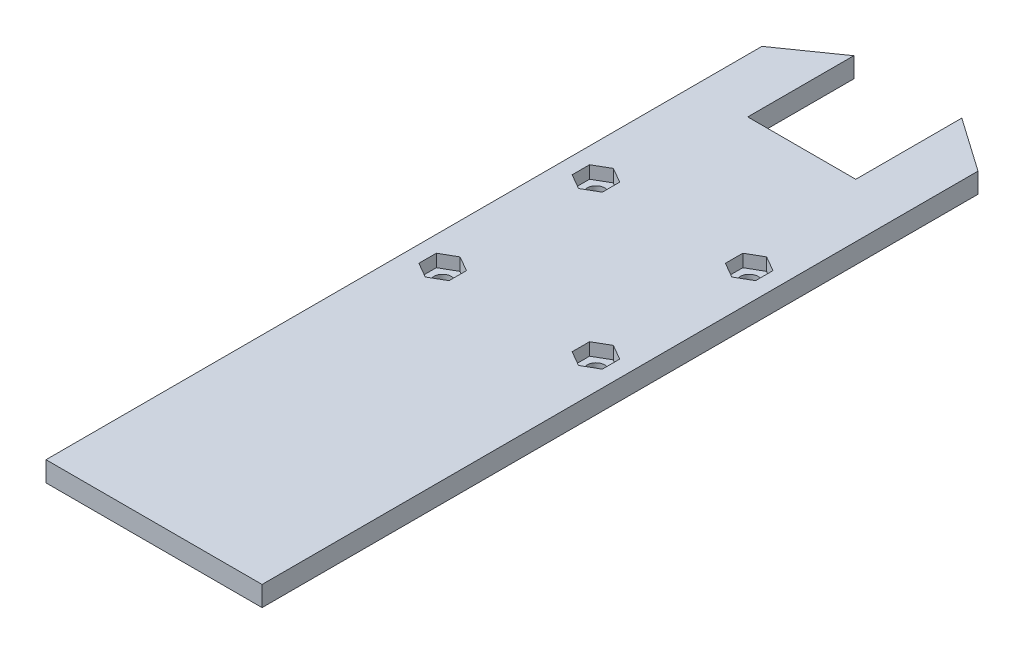
from build123d import *

# Parameters (mm, degrees)
SKETCH1_W           = 43
SKETCH1_H           = 150
BOSS_EXTRUDE1_DEPTH = 4
SKETCH2_W           = 10.57
SKETCH2_H           = 21.1
SKETCH2_W_2         = 10.75
CUT_EXTRUDE1_DEPTH  = 79.123299982
CUT_EXTRUDE2_DEPTH  = 2.5
SKETCH4_R           = 1.75
CUT_EXTRUDE3_DEPTH  = 79.123299982
SKETCH6_W           = 0.18
SKETCH6_H           = 21.1
CUT_EXTRUDE5_DEPTH  = 79.123299982
CUT_EXTRUDE6_DEPTH  = 79.123299982


with BuildPart() as part:
    # Sketch1 → Boss-Extrude1 (new body)
    with BuildSketch(Plane(origin=(0, 0, 0), x_dir=(1, 0, 0), z_dir=(0, 1, 0))):
        Rectangle(SKETCH1_W, SKETCH1_H)
    extrude(amount=BOSS_EXTRUDE1_DEPTH)

    # Sketch2 → Cut-Extrude1 (cut, through all)
    with BuildSketch(Plane(origin=(0, 4, 0), x_dir=(1, 0, 0), z_dir=(0, 1, 0))):
        with Locations((5.285, 64.45)):
            Rectangle(SKETCH2_W, SKETCH2_H)
        with Locations((-5.375, 64.45)):
            Rectangle(SKETCH2_W_2, SKETCH2_H)
    extrude(amount=-CUT_EXTRUDE1_DEPTH, mode=Mode.SUBTRACT)

    # Sketch3 → Cut-Extrude2 (cut)
    with BuildSketch(Plane(origin=(0, 4, 0), x_dir=(1, 0, 0), z_dir=(0, 1, 0))):
        Polygon((-15.25, 31.654101615), (-18.25, 29.922050808), (-18.25, 26.457949192), (-15.25, 24.725898385), (-12.25, 26.457949192), (-12.25, 29.922050808), align=None)
        Polygon((12.25, 29.922050808), (15.25, 31.654101615), (18.25, 29.922050808), (18.25, 26.457949192), (15.25, 24.725898385), (12.25, 26.457949192), align=None)
        Polygon((12.25, -0.577949192), (12.25, -4.042050808), (15.25, -5.774101615), (18.25, -4.042050808), (18.25, -0.577949192), (15.25, 1.154101615), align=None)
        Polygon((-12.25, -4.042050808), (-15.25, -5.774101615), (-18.25, -4.042050808), (-18.25, -0.577949192), (-15.25, 1.154101615), (-12.25, -0.577949192), align=None)
    extrude(amount=-CUT_EXTRUDE2_DEPTH, mode=Mode.SUBTRACT)

    # Sketch4 → Cut-Extrude3 (cut, through all)
    with BuildSketch(Plane(origin=(0, 4, 0), x_dir=(1, 0, 0), z_dir=(0, 1, 0))):
        with Locations((-15.25, 28.19)):
            Circle(SKETCH4_R)
        with Locations((15.25, 28.19)):
            Circle(SKETCH4_R)
        with Locations((15.25, -2.31)):
            Circle(SKETCH4_R)
        with Locations((-15.25, -2.31)):
            Circle(SKETCH4_R)
    extrude(amount=-CUT_EXTRUDE3_DEPTH, mode=Mode.SUBTRACT)

    # Sketch6 → Cut-Extrude5 (cut, through all)
    with BuildSketch(Plane(origin=(0, 4, 0), x_dir=(1, 0, 0), z_dir=(0, 1, 0))):
        with Locations((10.66, 64.45)):
            Rectangle(SKETCH6_W, SKETCH6_H)
    extrude(amount=-CUT_EXTRUDE5_DEPTH, mode=Mode.SUBTRACT)

    # Sketch5 → Cut-Extrude6 (cut, through all)
    with BuildSketch(Plane(origin=(0, 4, 0), x_dir=(1, 0, 0), z_dir=(0, 1, 0))):
        Polygon((-10.75, 75), (-21.5, 75), (-21.5, 67.472768964), align=None)
        Polygon((10.75, 75), (21.5, 75), (21.5, 67.472768964), align=None)
    extrude(amount=-CUT_EXTRUDE6_DEPTH, mode=Mode.SUBTRACT)


solid = part.part
